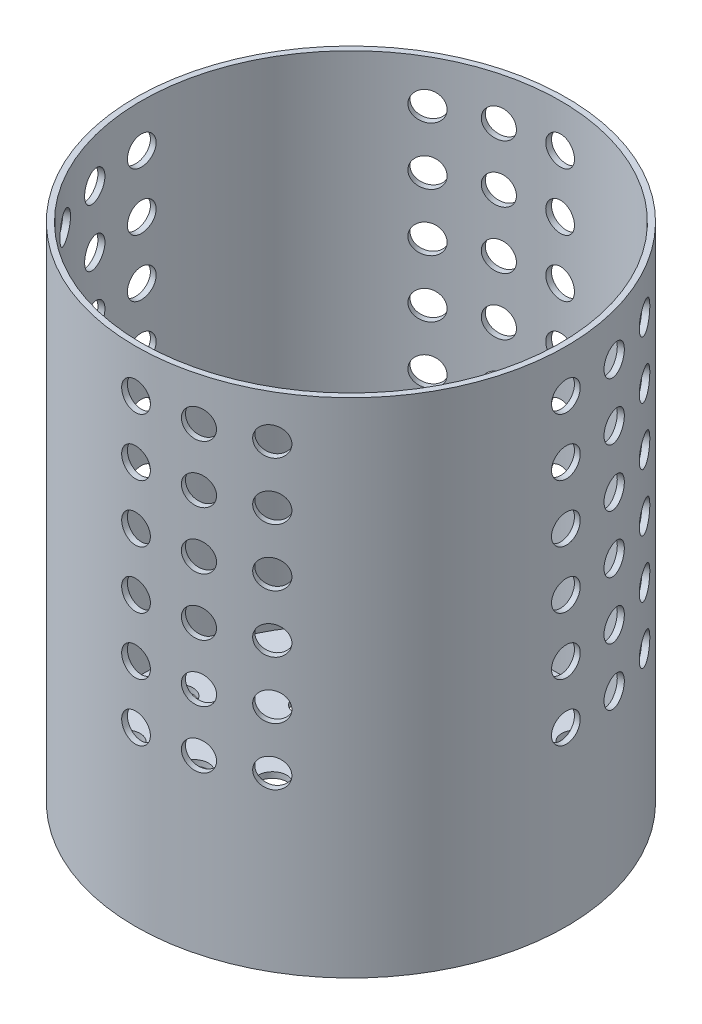
from build123d import *

# Parameters (mm, degrees)
SKETCH1_R                   = 75
BOSS_EXTRUDE1_DEPTH         = 175
SHELL1_T                    = -2
SKETCH2_R                   = 5
CUT_EXTRUDE1_DEPTH          = 25
CIRPATTERN1_COUNT           = 3
CIRPATTERN1_ANGLE           = 30
CIRPATTERN2_COUNT           = 4
CIRPATTERN2_COPY_1_SKETCH_R = 5
CIRPATTERN2_COPY_1_DEPTH    = 25
CIRPATTERN2_COPY_2_SKETCH_R = 5
CIRPATTERN2_COPY_2_DEPTH    = 25
CIRPATTERN2_COPY_3_SKETCH_R = 5
CIRPATTERN2_COPY_3_DEPTH    = 25
CIRPATTERN2_COPY_4_SKETCH_R = 5
CIRPATTERN2_COPY_4_DEPTH    = 25
CIRPATTERN2_COPY_5_SKETCH_R = 5
CIRPATTERN2_COPY_5_DEPTH    = 25
CIRPATTERN2_COPY_6_SKETCH_R = 5
CIRPATTERN2_COPY_6_DEPTH    = 25
SKETCH3_R                   = 5
CUT_EXTRUDE2_DEPTH          = 25


with BuildPart() as part:
    # Sketch1 → Boss-Extrude1 (new body)
    with BuildSketch(Plane(origin=(0, 0, 0), x_dir=(1, 0, 0), z_dir=(0, 1, 0))):
        with Locations(Location((0, 0, 0), (0, 0, 270))):
            Circle(SKETCH1_R)
    extrude(amount=BOSS_EXTRUDE1_DEPTH)

    # Shell1
    shell1_openings = [part.faces().sort_by_distance(p)[0] for p in [
        (0, 175, 0),
    ]]
    offset(amount=SHELL1_T, openings=shell1_openings, kind=Kind.INTERSECTION)

    # Sketch2 → Cut-Extrude1 (cut)
    with BuildSketch(Plane(origin=(75, 0, 0), x_dir=(0, 0, -1), z_dir=(1, 0, 0))):
        with Locations((0, 160)):
            Circle(SKETCH2_R)
        with Locations((0, 140)):
            Circle(SKETCH2_R)
        with Locations((0, 120)):
            Circle(SKETCH2_R)
        with Locations((0, 100)):
            Circle(SKETCH2_R)
        with Locations((0, 80)):
            Circle(SKETCH2_R)
        with Locations((0, 60)):
            Circle(SKETCH2_R)
    cut_extrude1 = extrude(amount=-CUT_EXTRUDE1_DEPTH, mode=Mode.SUBTRACT)

    # CirPattern1: Cut-Extrude1 ×3 about axis
    cirpattern1_axis = Axis((0, 175, 0), (0, 1, 0))
    for i in range(1, CIRPATTERN1_COUNT):
        add(cut_extrude1.rotate(cirpattern1_axis, i * CIRPATTERN1_ANGLE / (CIRPATTERN1_COUNT - 1)), mode=Mode.SUBTRACT)

    # CirPattern2: Cut-Extrude1 ×4 about axis
    cirpattern2_axis = Axis((0, 175, 0), (0, -1, 0))
    for i in range(1, CIRPATTERN2_COUNT):
        add(cut_extrude1.rotate(cirpattern2_axis, i * 360 / CIRPATTERN2_COUNT), mode=Mode.SUBTRACT)

    # CirPattern2 copy 1 sketch → CirPattern2 copy 1 (cut)
    with BuildSketch(Plane(origin=(19.411428383, 0, 72.444436972), x_dir=(0.9659258262890681, 0, -0.25881904510252146), z_dir=(0.25881904510252146, 0, 0.9659258262890681))):
        with Locations((0, 160)):
            Circle(CIRPATTERN2_COPY_1_SKETCH_R)
        with Locations((0, 140)):
            Circle(CIRPATTERN2_COPY_1_SKETCH_R)
        with Locations((0, 120)):
            Circle(CIRPATTERN2_COPY_1_SKETCH_R)
        with Locations((0, 100)):
            Circle(CIRPATTERN2_COPY_1_SKETCH_R)
        with Locations((0, 80)):
            Circle(CIRPATTERN2_COPY_1_SKETCH_R)
        with Locations((0, 60)):
            Circle(CIRPATTERN2_COPY_1_SKETCH_R)
    extrude(amount=-CIRPATTERN2_COPY_1_DEPTH, mode=Mode.SUBTRACT)

    # CirPattern2 copy 2 sketch → CirPattern2 copy 2 (cut)
    with BuildSketch(Plane(origin=(-72.444436972, 0, 19.411428383), x_dir=(0.2588190451025215, 0, 0.9659258262890681), z_dir=(-0.9659258262890681, 0, 0.2588190451025215))):
        with Locations((0, 160)):
            Circle(CIRPATTERN2_COPY_2_SKETCH_R)
        with Locations((0, 140)):
            Circle(CIRPATTERN2_COPY_2_SKETCH_R)
        with Locations((0, 120)):
            Circle(CIRPATTERN2_COPY_2_SKETCH_R)
        with Locations((0, 100)):
            Circle(CIRPATTERN2_COPY_2_SKETCH_R)
        with Locations((0, 80)):
            Circle(CIRPATTERN2_COPY_2_SKETCH_R)
        with Locations((0, 60)):
            Circle(CIRPATTERN2_COPY_2_SKETCH_R)
    extrude(amount=-CIRPATTERN2_COPY_2_DEPTH, mode=Mode.SUBTRACT)

    # CirPattern2 copy 3 sketch → CirPattern2 copy 3 (cut)
    with BuildSketch(Plane(origin=(-19.411428383, 0, -72.444436972), x_dir=(-0.9659258262890681, 0, 0.25881904510252157), z_dir=(-0.25881904510252157, 0, -0.9659258262890681))):
        with Locations((0, 160)):
            Circle(CIRPATTERN2_COPY_3_SKETCH_R)
        with Locations((0, 140)):
            Circle(CIRPATTERN2_COPY_3_SKETCH_R)
        with Locations((0, 120)):
            Circle(CIRPATTERN2_COPY_3_SKETCH_R)
        with Locations((0, 100)):
            Circle(CIRPATTERN2_COPY_3_SKETCH_R)
        with Locations((0, 80)):
            Circle(CIRPATTERN2_COPY_3_SKETCH_R)
        with Locations((0, 60)):
            Circle(CIRPATTERN2_COPY_3_SKETCH_R)
    extrude(amount=-CIRPATTERN2_COPY_3_DEPTH, mode=Mode.SUBTRACT)

    # CirPattern2 copy 4 sketch → CirPattern2 copy 4 (cut)
    with BuildSketch(Plane(origin=(37.5, 0, 64.951905284), x_dir=(0.866025403784438, 0, -0.5000000000000011), z_dir=(0.5000000000000011, 0, 0.866025403784438))):
        with Locations((0, 160)):
            Circle(CIRPATTERN2_COPY_4_SKETCH_R)
        with Locations((0, 140)):
            Circle(CIRPATTERN2_COPY_4_SKETCH_R)
        with Locations((0, 120)):
            Circle(CIRPATTERN2_COPY_4_SKETCH_R)
        with Locations((0, 100)):
            Circle(CIRPATTERN2_COPY_4_SKETCH_R)
        with Locations((0, 80)):
            Circle(CIRPATTERN2_COPY_4_SKETCH_R)
        with Locations((0, 60)):
            Circle(CIRPATTERN2_COPY_4_SKETCH_R)
    extrude(amount=-CIRPATTERN2_COPY_4_DEPTH, mode=Mode.SUBTRACT)

    # CirPattern2 copy 5 sketch → CirPattern2 copy 5 (cut)
    with BuildSketch(Plane(origin=(-64.951905284, 0, 37.5), x_dir=(0.5000000000000012, 0, 0.8660254037844379), z_dir=(-0.8660254037844379, 0, 0.5000000000000012))):
        with Locations((0, 160)):
            Circle(CIRPATTERN2_COPY_5_SKETCH_R)
        with Locations((0, 140)):
            Circle(CIRPATTERN2_COPY_5_SKETCH_R)
        with Locations((0, 120)):
            Circle(CIRPATTERN2_COPY_5_SKETCH_R)
        with Locations((0, 100)):
            Circle(CIRPATTERN2_COPY_5_SKETCH_R)
        with Locations((0, 80)):
            Circle(CIRPATTERN2_COPY_5_SKETCH_R)
        with Locations((0, 60)):
            Circle(CIRPATTERN2_COPY_5_SKETCH_R)
    extrude(amount=-CIRPATTERN2_COPY_5_DEPTH, mode=Mode.SUBTRACT)

    # CirPattern2 copy 6 sketch → CirPattern2 copy 6 (cut)
    with BuildSketch(Plane(origin=(-37.5, 0, -64.951905284), x_dir=(-0.8660254037844379, 0, 0.5000000000000012), z_dir=(-0.5000000000000012, 0, -0.8660254037844379))):
        with Locations((0, 160)):
            Circle(CIRPATTERN2_COPY_6_SKETCH_R)
        with Locations((0, 140)):
            Circle(CIRPATTERN2_COPY_6_SKETCH_R)
        with Locations((0, 120)):
            Circle(CIRPATTERN2_COPY_6_SKETCH_R)
        with Locations((0, 100)):
            Circle(CIRPATTERN2_COPY_6_SKETCH_R)
        with Locations((0, 80)):
            Circle(CIRPATTERN2_COPY_6_SKETCH_R)
        with Locations((0, 60)):
            Circle(CIRPATTERN2_COPY_6_SKETCH_R)
    extrude(amount=-CIRPATTERN2_COPY_6_DEPTH, mode=Mode.SUBTRACT)

    # Sketch3 → Cut-Extrude2 (cut)
    with BuildSketch(Plane.XZ):
        with Locations(Location((0, 0, 0), (0, 0, 270))):
            Circle(SKETCH3_R)
        with Locations(Location((0, 20, 0), (0, 0, 270))):
            Circle(SKETCH3_R)
        with Locations(Location((0, 40, 0), (0, 0, 270))):
            Circle(SKETCH3_R)
        with Locations(Location((0, 60, 0), (0, 0, 270))):
            Circle(SKETCH3_R)
        with Locations(Location((17.320508076, 10, 0), (0, 0, 270))):
            Circle(SKETCH3_R)
        with Locations(Location((17.320508076, -10, 0), (0, 0, 270))):
            Circle(SKETCH3_R)
        with Locations(Location((0, -20, 0), (0, 0, 270))):
            Circle(SKETCH3_R)
        with Locations(Location((-17.320508076, -10, 0), (0, 0, 270))):
            Circle(SKETCH3_R)
        with Locations(Location((-17.320508076, 10, 0), (0, 0, 270))):
            Circle(SKETCH3_R)
        with Locations(Location((20, 34.641016151, 0), (0, 0, 270))):
            Circle(SKETCH3_R)
        with Locations(Location((34.641016151, 20, 0), (0, 0, 270))):
            Circle(SKETCH3_R)
        with Locations(Location((40, 0, 0), (0, 0, 270))):
            Circle(SKETCH3_R)
        with Locations(Location((34.641016151, -20, 0), (0, 0, 270))):
            Circle(SKETCH3_R)
        with Locations(Location((20, -34.641016151, 0), (0, 0, 270))):
            Circle(SKETCH3_R)
        with Locations(Location((0, -40, 0), (0, 0, 270))):
            Circle(SKETCH3_R)
        with Locations(Location((-20, -34.641016151, 0), (0, 0, 270))):
            Circle(SKETCH3_R)
        with Locations(Location((-34.641016151, -20, 0), (0, 0, 270))):
            Circle(SKETCH3_R)
        with Locations(Location((-40, 0, 0), (0, 0, 270))):
            Circle(SKETCH3_R)
        with Locations(Location((-34.641016151, 20, 0), (0, 0, 270))):
            Circle(SKETCH3_R)
        with Locations(Location((-20, 34.641016151, 0), (0, 0, 270))):
            Circle(SKETCH3_R)
        with Locations(Location((22.961005942, 55.432771951, 0), (0, 0, 270))):
            Circle(SKETCH3_R)
        with Locations(Location((42.426406871, 42.426406871, 0), (0, 0, 270))):
            Circle(SKETCH3_R)
        with Locations(Location((55.432771951, 22.961005942, 0), (0, 0, 270))):
            Circle(SKETCH3_R)
        with Locations(Location((60, 0, 0), (0, 0, 270))):
            Circle(SKETCH3_R)
        with Locations(Location((55.432771951, -22.961005942, 0), (0, 0, 270))):
            Circle(SKETCH3_R)
        with Locations(Location((42.426406871, -42.426406871, 0), (0, 0, 270))):
            Circle(SKETCH3_R)
        with Locations(Location((22.961005942, -55.432771951, 0), (0, 0, 270))):
            Circle(SKETCH3_R)
        with Locations(Location((0, -60, 0), (0, 0, 270))):
            Circle(SKETCH3_R)
        with Locations(Location((-22.961005942, -55.432771951, 0), (0, 0, 270))):
            Circle(SKETCH3_R)
        with Locations(Location((-42.426406871, -42.426406871, 0), (0, 0, 270))):
            Circle(SKETCH3_R)
        with Locations(Location((-55.432771951, -22.961005942, 0), (0, 0, 270))):
            Circle(SKETCH3_R)
        with Locations(Location((-60, 0, 0), (0, 0, 270))):
            Circle(SKETCH3_R)
        with Locations(Location((-55.432771951, 22.961005942, 0), (0, 0, 270))):
            Circle(SKETCH3_R)
        with Locations(Location((-42.426406871, 42.426406871, 0), (0, 0, 270))):
            Circle(SKETCH3_R)
        with Locations(Location((-22.961005942, 55.432771951, 0), (0, 0, 270))):
            Circle(SKETCH3_R)
    extrude(amount=-CUT_EXTRUDE2_DEPTH, mode=Mode.SUBTRACT)


solid = part.part
